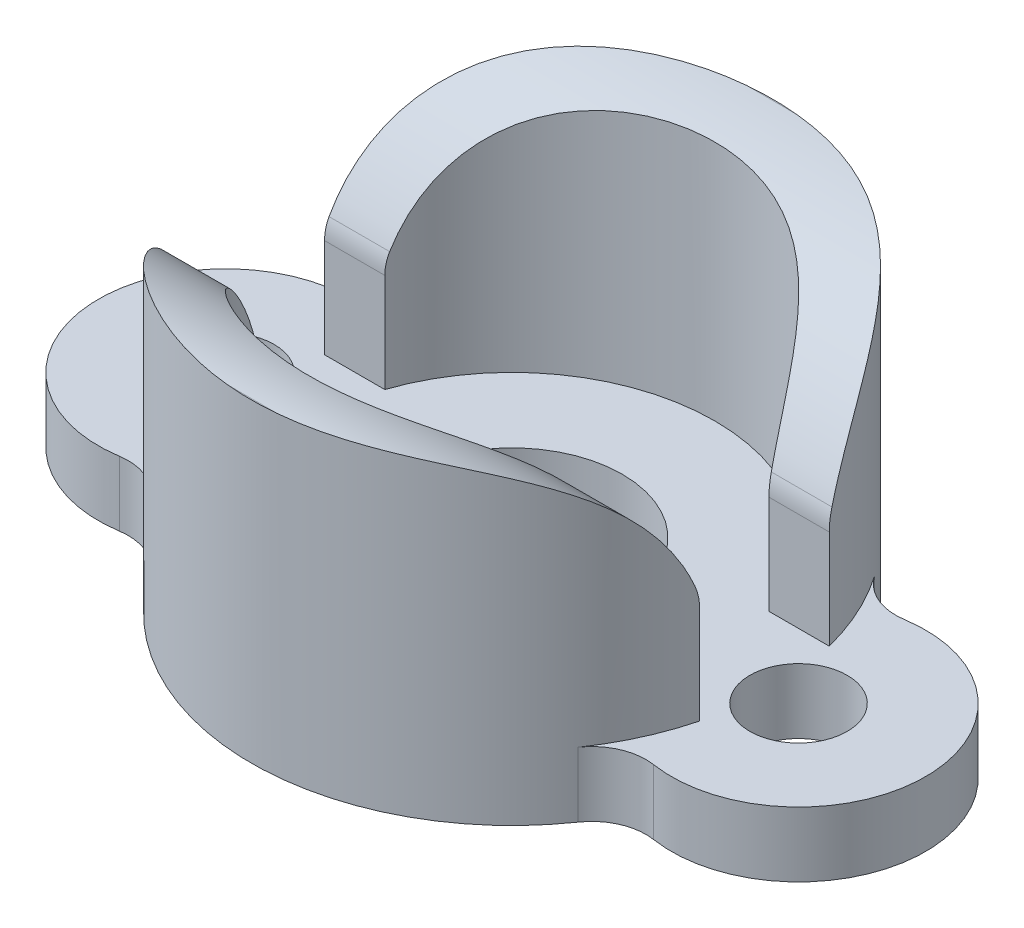
from build123d import *

# Parameters (mm, degrees)
SKETCH1_R               = 2.591205892
SKETCH1_R_2             = 1.143
BOSS_EXTRUDE4_DEPTH     = 1.524
SKETCH5_R               = 6.1214
SKETCH5_R_2             = 4.7625
BOSS_EXTRUDE6_DEPTH     = 5.8674
CUT_EXTRUDE1_DEPTH      = 14.656327184
CUT_EXTRUDE1_DEPTH_BACK = 14.656327184


with BuildPart() as part:
    # Sketch1 → Boss-Extrude4 (new body)
    with BuildSketch(Plane(origin=(0, 0, 0), x_dir=(1, 0, 0), z_dir=(0, 1, 0))):
        with BuildLine():
            ThreePointArc((6.273777289, -2.949269001), (9.7155, 0), (6.273777289, 2.949269001))
            ThreePointArc((6.273777289, 2.949269001), (5.577680109, 3.037502335), (5.034675871, 3.481892708))
            ThreePointArc((5.034675871, 3.481892708), (0, 6.1214), (-5.034675871, 3.481892708))
            ThreePointArc((-5.034675871, 3.481892708), (-5.577680109, 3.037502335), (-6.273777289, 2.949269001))
            ThreePointArc((-6.273777289, 2.949269001), (-9.7155, 0), (-6.273777289, -2.949269001))
            ThreePointArc((-6.273777289, -2.949269001), (-5.577680109, -3.037502335), (-5.034675871, -3.481892708))
            ThreePointArc((-5.034675871, -3.481892708), (0, -6.1214), (5.034675871, -3.481892708))
            ThreePointArc((5.034675871, -3.481892708), (5.577680109, -3.037502335), (6.273777289, -2.949269001))
        make_face()
        Circle(SKETCH1_R, mode=Mode.SUBTRACT)
        with Locations((6.731, 0)):
            Circle(SKETCH1_R_2, mode=Mode.SUBTRACT)
        with Locations((-6.731, 0)):
            Circle(SKETCH1_R_2, mode=Mode.SUBTRACT)
    extrude(amount=BOSS_EXTRUDE4_DEPTH)

    # Sketch5 → Boss-Extrude6 (add)
    with BuildSketch(Plane(origin=(0, 1.524, 0), x_dir=(1, 0, 0), z_dir=(0, 1, 0))):
        Circle(SKETCH5_R)
        Circle(SKETCH5_R_2, mode=Mode.SUBTRACT)
    extrude(amount=BOSS_EXTRUDE6_DEPTH)

    # Sketch6 → Cut-Extrude1 (cut, two sides: drawn at the far end of the back side and taken through both)
    with BuildSketch(Plane(origin=(0, 0, 0), x_dir=(0, 0, -1), z_dir=(1, 0, 0)).offset(-CUT_EXTRUDE1_DEPTH_BACK)):
        with BuildLine():
            Line((-1.524, 3.846535004), (-1.524, 1.524))
            Line((-1.524, 1.524), (1.524, 1.524))
            Line((1.524, 1.524), (1.524, 3.846535004))
            ThreePointArc((1.524, 3.846535004), (1.545376148, 4.078566202), (1.608785003, 4.302786482))
            ThreePointArc((1.608785003, 4.302786482), (3.384739438, 6.548912496), (6.1214, 7.3914))
            Line((6.1214, 7.3914), (-6.1214, 7.3914))
            ThreePointArc((-6.1214, 7.3914), (-3.384739438, 6.548912496), (-1.608785003, 4.302786482))
            ThreePointArc((-1.608785003, 4.302786482), (-1.545376148, 4.078566202), (-1.524, 3.846535004))
        make_face()
    extrude(amount=CUT_EXTRUDE1_DEPTH + CUT_EXTRUDE1_DEPTH_BACK, mode=Mode.SUBTRACT)


solid = part.part
